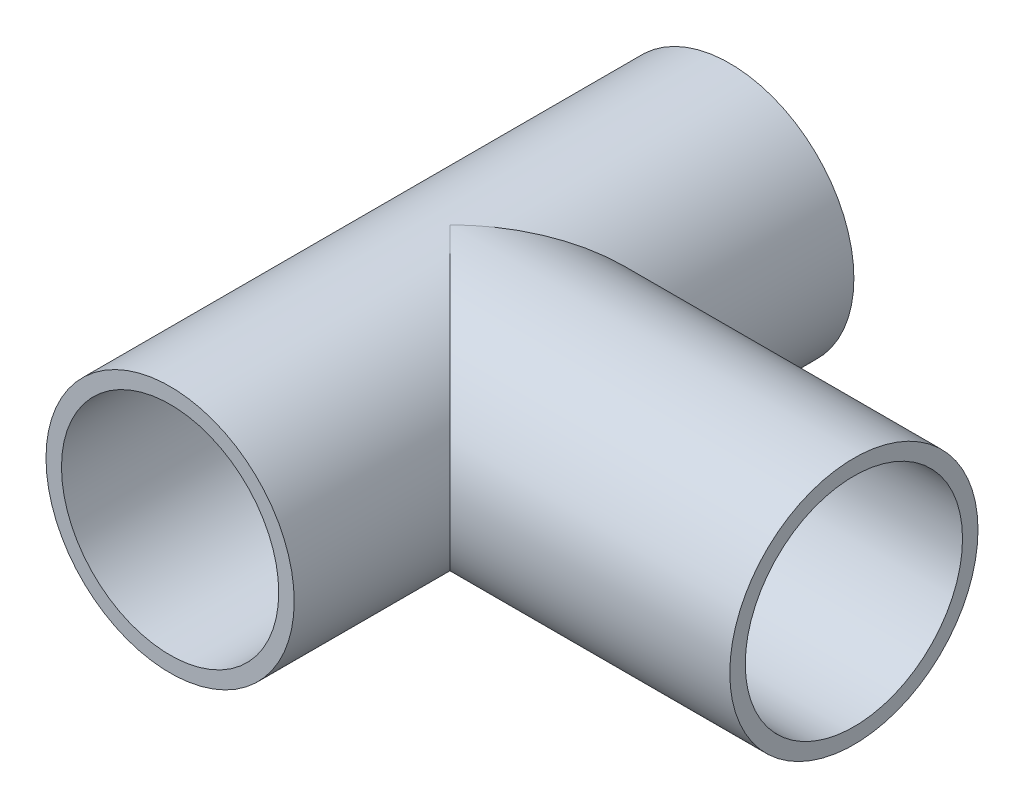
from build123d import *

# Parameters (mm, degrees)
THROUGH_SECTION_R                        = 161.925
THROUGH_SECTION_R_2                      = 141.732
THROUGH_SECTION_EXTRUDE_DEPTH            = 730.25
ORTHOGONAL_SECTION_OD_EXTRUDE_REACH      = 1018.942
ORTHOGONAL_SECTION_OD_EXTRUDE_END_RADIUS = 161.925
ORTHOGONAL_SECTION_OD_R                  = 161.925
ORTHOGONAL_SECTION_ID_CUT_REACH          = 1018.942
ORTHOGONAL_SECTION_ID_R                  = 141.732


with BuildPart() as part:
    # Through Section → Through Section Extrude (new body)
    with BuildSketch(Plane.XY):
        Circle(THROUGH_SECTION_R)
        Circle(THROUGH_SECTION_R_2, mode=Mode.SUBTRACT)
    extrude(amount=THROUGH_SECTION_EXTRUDE_DEPTH)

    # Orthogonal Section OD Extrude: up to this cylinder (the profile starts outside it)
    orthogonal_section_od_extrude_end = Plane(origin=(0, 0, 365.125), z_dir=(0, 0, -1)) * Cylinder(ORTHOGONAL_SECTION_OD_EXTRUDE_END_RADIUS, 2362.734, mode=Mode.PRIVATE)
    # Orthogonal Section OD → Orthogonal Section OD Extrude (add, up to the surface)
    with BuildSketch(Plane(origin=(527.05, 0, 0), x_dir=(0, 0, -1), z_dir=(1, 0, 0)), mode=Mode.PRIVATE) as orthogonal_section_od_extrude_sk1:
        with Locations((-365.125, 0)):
            Circle(ORTHOGONAL_SECTION_OD_R)
    orthogonal_section_od_extrude_tool1 = extrude(orthogonal_section_od_extrude_sk1.sketch, amount=-ORTHOGONAL_SECTION_OD_EXTRUDE_REACH, mode=Mode.PRIVATE) - orthogonal_section_od_extrude_end
    add(orthogonal_section_od_extrude_tool1.solids().sort_by_distance((527.05, 0, 365.125))[0])

    # Orthogonal Section ID → Orthogonal Section ID Cut (cut, up to next)
    with BuildSketch(Plane(origin=(527.05, 0, 0), x_dir=(0, 0, -1), z_dir=(1, 0, 0)), mode=Mode.PRIVATE) as orthogonal_section_id_cut_sk1:
        with Locations((-365.125, 0)):
            Circle(ORTHOGONAL_SECTION_ID_R)
    orthogonal_section_id_cut_tool1 = extrude(orthogonal_section_id_cut_sk1.sketch, amount=-ORTHOGONAL_SECTION_ID_CUT_REACH, mode=Mode.PRIVATE) & part.part
    add(orthogonal_section_id_cut_tool1.solids().sort_by_distance((527.05, 0, 365.125))[0], mode=Mode.SUBTRACT)


solid = part.part
